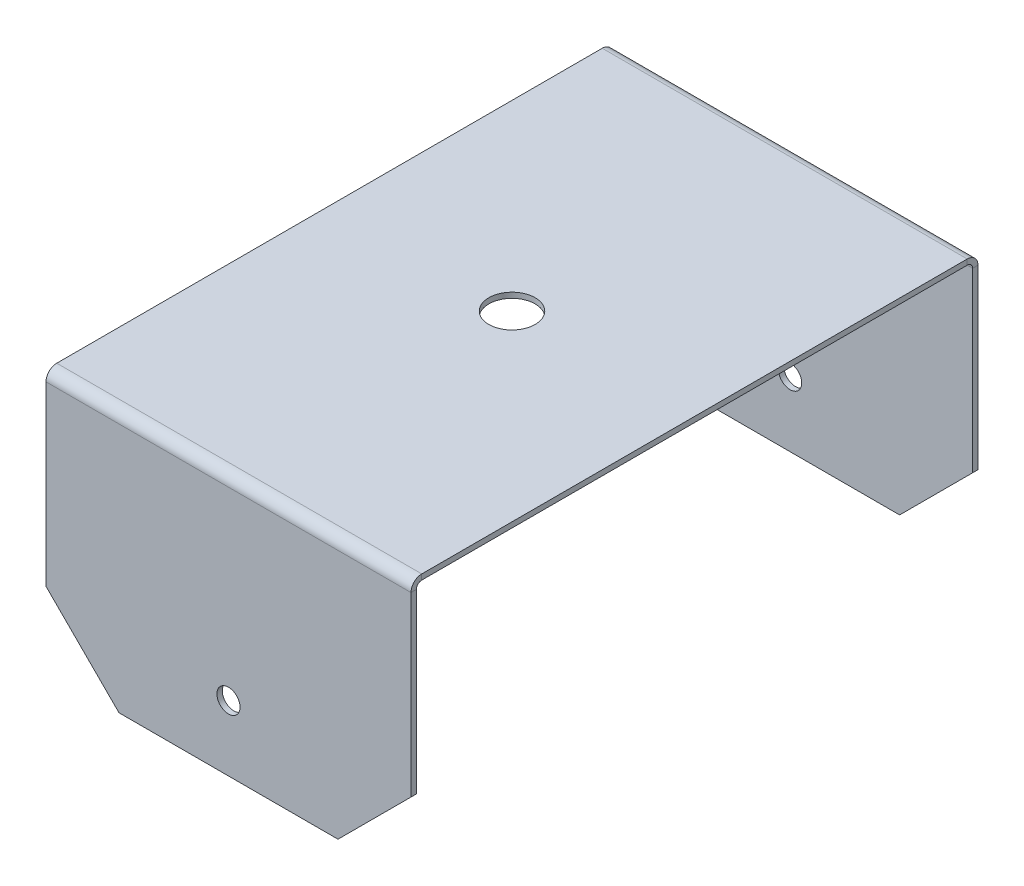
from build123d import *

# Parameters (mm, degrees)
BASE_FLANGE1_DEPTH      = 25
BASE_FLANGE1_DEPTH_BACK = 25
SKETCH6_R               = 1.5875
CUT_EXTRUDE1_DEPTH      = 89.786969755
SKETCH7_R               = 3.175
CUT_EXTRUDE2_DEPTH      = 10
CHAMFER1_SIZE           = 10


# Sheet-metal steps are written as plain solids
with BuildPart() as part:
    # Sketch1 → Base-Flange1 (new, two sides: drawn at the far end of the back side and taken through both)
    with BuildSketch(Plane(origin=(0, 0, 0), x_dir=(0, 0, -1), z_dir=(1, 0, 0)).offset(-BASE_FLANGE1_DEPTH_BACK)):
        with BuildLine():
            Line((-38.1, -35), (-38.1, -0.7366))
            ThreePointArc((-38.1, -0.7366), (-37.884254855, -0.215745145), (-37.3634, 0))
            Line((-37.3634, 0), (37.3634, 0))
            ThreePointArc((37.3634, 0), (37.884254855, -0.215745145), (38.1, -0.7366))
            Line((38.1, -0.7366), (38.1, -35))
            Line((38.1, -35), (38.8366, -35))
            Line((38.8366, -35), (38.8366, -0.7366))
            ThreePointArc((38.8366, -0.7366), (38.40510971, 0.30510971), (37.3634, 0.7366))
            Line((37.3634, 0.7366), (-37.3634, 0.7366))
            ThreePointArc((-37.3634, 0.7366), (-38.40510971, 0.30510971), (-38.8366, -0.7366))
            Line((-38.8366, -0.7366), (-38.8366, -35))
            Line((-38.8366, -35), (-38.1, -35))
        make_face()
    extrude(amount=BASE_FLANGE1_DEPTH + BASE_FLANGE1_DEPTH_BACK)

    # Sketch6 → Cut-Extrude1 (cut, through all)
    with BuildSketch(Plane(origin=(0, 0, -38.8366), x_dir=(-1, 0, 0), z_dir=(0, 0, -1))):
        with Locations(Location((0, -26.05331339, 0), (0, 0, 90))):
            Circle(SKETCH6_R)
    extrude(amount=-CUT_EXTRUDE1_DEPTH, mode=Mode.SUBTRACT)

    # Sketch7 → Cut-Extrude2 (cut)
    with BuildSketch(Plane(origin=(0, 0.7366, 0), x_dir=(1, 0, 0), z_dir=(0, 1, 0))):
        with Locations(Location((0, 0, 0), (0, 0, 270))):
            Circle(SKETCH7_R)
    extrude(amount=-CUT_EXTRUDE2_DEPTH, mode=Mode.SUBTRACT)

    # Chamfer1
    chamfer1_edges = [part.edges().sort_by_distance(p)[0] for p in [
        (25, -35, -38.4683),
        (-25, -35, -38.4683),
        (-25, -35, 38.4683),
        (25, -35, 38.4683),
    ]]
    chamfer(chamfer1_edges, length=CHAMFER1_SIZE)


solid = part.part
